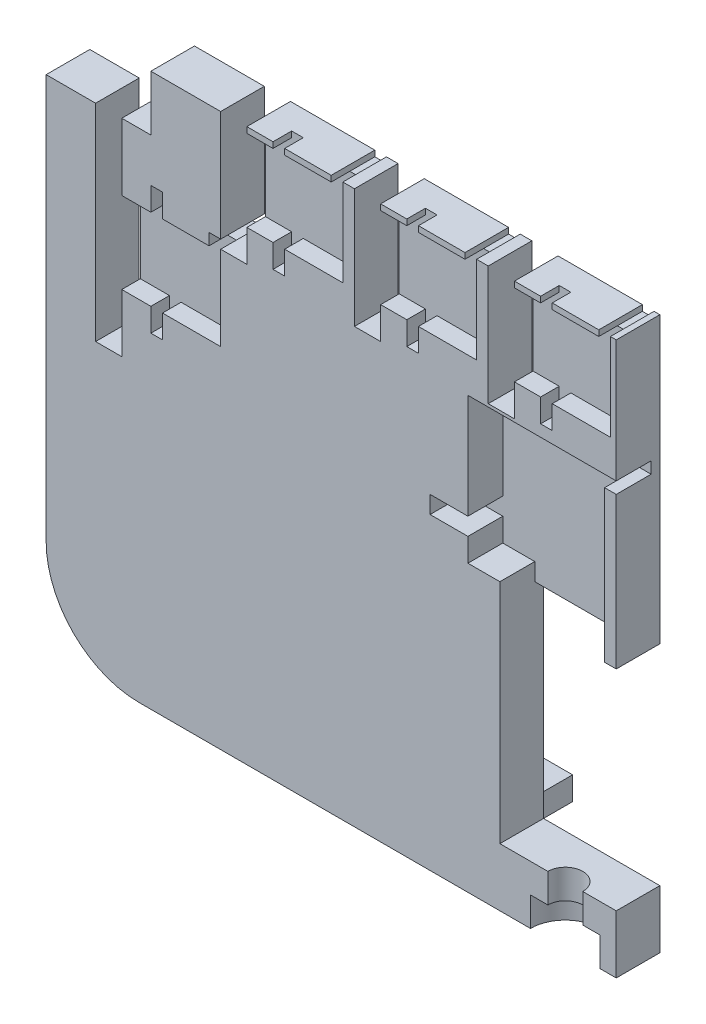
from build123d import *
from OCP.BRepAlgoAPI import BRepAlgoAPI_Cut
from OCP.TopTools import TopTools_ListOfShape
from build123d.topology import SkipClean

# Parameters (mm, degrees)
BOSS_EXTRUDE1_DEPTH = 7.5
CUT_EXTRUDE1_DEPTH  = 3.2
CUT_EXTRUDE4_REACH  = 70.655
SKETCH5_W           = 3
SKETCH5_H           = 17
CUT_EXTRUDE5_REACH  = 70.655
SKETCH8_W           = 12
SKETCH8_H           = 37
CUT_EXTRUDE6_DEPTH  = 3.2
SKETCH10_W          = 10
SKETCH10_H          = 7.5
BOSS_EXTRUDE2_DEPTH = 27.486353186
SKETCH11_W          = 3
SKETCH11_H          = 7.5
CUT_EXTRUDE7_DEPTH  = 3.5
SKETCH12_W          = 2
SKETCH12_H          = 7.5
CUT_EXTRUDE8_DEPTH  = 4
SKETCH13_W          = 2
SKETCH13_H          = 7.5
CUT_EXTRUDE9_DEPTH  = 4
SKETCH14_W          = 7.5
SKETCH14_H          = 9.5
CUT_EXTRUDE10_DEPTH = 6
SKETCH16_W          = 1.5
SKETCH16_H          = 7.5
CUT_EXTRUDE12_DEPTH = 35.486360958
CUT_EXTRUDE13_DEPTH = 6
SKETCH19_W          = 17.5
SKETCH19_H          = 32
BOSS_EXTRUDE3_DEPTH = 7.5
CUT_EXTRUDE14_DEPTH = 6
SKETCH20_W          = 18
SKETCH20_H          = 6
CUT_EXTRUDE15_DEPTH = 6
SKETCH21_W          = 20
SKETCH21_H          = 33
CUT_EXTRUDE16_DEPTH = 11
CUT_EXTRUDE17_DEPTH = 5
CUT_EXTRUDE18_DEPTH = 10
SKETCH23_W          = 50
SKETCH23_H          = 4
BOSS_EXTRUDE4_DEPTH = 15
SKETCH25_R          = 3.5
CUT_EXTRUDE19_DEPTH = 10
SKETCH26_W          = 1.5
SKETCH26_H          = 20.5
CUT_EXTRUDE20_DEPTH = 8
SKETCH27_W          = 1.5
SKETCH27_H          = 20.5
CUT_EXTRUDE21_DEPTH = 8
SKETCH28_W          = 1.5
SKETCH28_H          = 20.5
CUT_EXTRUDE22_DEPTH = 8
CUT_EXTRUDE25_REACH = 73.857
SKETCH35_W          = 2
SKETCH35_H          = 2
SKETCH35_H_2        = 1
SKETCH36_W          = 1
SKETCH36_H          = 7.5
CUT_EXTRUDE26_DEPTH = 35.5
SKETCH37_W          = 7.5
SKETCH37_H          = 3
CUT_EXTRUDE27_DEPTH = 20


with BuildPart() as part:
    # Sketch1 → Boss-Extrude1 (new body)
    with BuildSketch(Plane.XY):
        with BuildLine():
            Line((-33, -47.5), (49, -47.5))
            Line((49, -47.5), (49, -29.5))
            Line((49, -29.5), (31.5, -29.5))
            Line((31.5, -29.5), (31.5, 2.5))
            Line((31.5, 2.5), (49, 2.5))
            Line((49, 2.5), (49, 47.5))
            Line((49, 47.5), (30, 47.5))
            Line((30, 47.5), (30, 30.5))
            Line((30, 30.5), (27, 30.5))
            Line((27, 30.5), (27, 47.5))
            Line((27, 47.5), (-49, 47.5))
            Line((-49, 47.5), (-49, -31.5))
            ThreePointArc((-49, -31.5), (-44.313708499, -42.813708499), (-33, -47.5))
        make_face()
    extrude(amount=BOSS_EXTRUDE1_DEPTH)

    # Sketch2 → Cut-Extrude1 (cut)
    with BuildSketch(Plane.XY.offset(7.5)):
        Polygon((30, 40), (31, 40), (31, 32.5), (36, 32.5), (36, 28.5), (38, 28.5), (38, 32.5), (48, 32.5), (48, 46.5), (38, 46.5), (38, 47.5), (36, 47.5), (36, 46.5), (31, 46.5), (31, 45), (30, 45), align=None)
        Polygon((-16, 40), (-15, 40), (-15, 32.5), (-10, 32.5), (-10, 28.5), (-8, 28.5), (-8, 32.5), (2, 32.5), (2, 46.5), (-8, 46.5), (-8, 47.5), (-10, 47.5), (-10, 46.5), (-15, 46.5), (-15, 45), (-16, 45), align=None)
        Polygon((7, 40), (8, 40), (8, 32.5), (13, 32.5), (13, 28.5), (15, 28.5), (15, 32.5), (25, 32.5), (25, 46.5), (15, 46.5), (15, 47.5), (13, 47.5), (13, 46.5), (8, 46.5), (8, 45), (7, 45), align=None)
    extrude(amount=-CUT_EXTRUDE1_DEPTH, mode=Mode.SUBTRACT)

    # Sketch5 → Cut-Extrude4 (cut, up to next)
    with BuildSketch(Plane.XY.offset(7.5), mode=Mode.PRIVATE) as cut_extrude4_sk1:
        with Locations((5.5, 39)):
            Rectangle(SKETCH5_W, SKETCH5_H)
    cut_extrude4_tool1 = extrude(cut_extrude4_sk1.sketch, amount=-CUT_EXTRUDE4_REACH, mode=Mode.PRIVATE) & part.part
    # Sketch5 → Cut-Extrude4 (cut, up to next)
    with BuildSketch(Plane.XY.offset(7.5), mode=Mode.PRIVATE) as cut_extrude4_sk2:
        with Locations((-17.5, 39)):
            Rectangle(SKETCH5_W, SKETCH5_H)
    cut_extrude4_tool2 = extrude(cut_extrude4_sk2.sketch, amount=-CUT_EXTRUDE4_REACH, mode=Mode.PRIVATE) & part.part
    add(cut_extrude4_tool1.solids().sort_by_distance((5.5, 39, 7.5))[0], mode=Mode.SUBTRACT)
    add(cut_extrude4_tool2.solids().sort_by_distance((-17.5, 39, 7.5))[0], mode=Mode.SUBTRACT)

    # Sketch8 → Cut-Extrude5 (cut, up to next)
    with BuildSketch(Plane.XY.offset(7.5), mode=Mode.PRIVATE) as cut_extrude5_sk1:
        with Locations((-43, 29)):
            Rectangle(SKETCH8_W, SKETCH8_H)
    cut_extrude5_tool1 = extrude(cut_extrude5_sk1.sketch, amount=-CUT_EXTRUDE5_REACH, mode=Mode.PRIVATE) & part.part
    add(cut_extrude5_tool1.solids().sort_by_distance((-43, 29, 7.5))[0], mode=Mode.SUBTRACT)

    # Sketch9 → Cut-Extrude6 (cut)
    with BuildSketch(Plane.XY.offset(7.5)):
        Polygon((-37, 20), (-36, 20), (-36, 12.5), (-31, 12.5), (-31, 8.5), (-29, 8.5), (-29, 12.5), (-19, 12.5), (-19, 26.5), (-29, 26.5), (-29, 30.5), (-31, 30.5), (-31, 26.5), (-36, 26.5), (-36, 25), (-37, 25), align=None)
    extrude(amount=-CUT_EXTRUDE6_DEPTH, mode=Mode.SUBTRACT)

    # Sketch10 → Boss-Extrude2 (add)
    with BuildSketch(Plane(origin=(0, 10.5, 0), x_dir=(1, 0, 0), z_dir=(0, 1, 0))):
        with Locations((-44, -3.75)):
            Rectangle(SKETCH10_W, SKETCH10_H)
    extrude(amount=BOSS_EXTRUDE2_DEPTH)

    # Sketch11 → Cut-Extrude7 (cut)
    with BuildSketch(Plane(origin=(0, 30.5, 0), x_dir=(1, 0, 0), z_dir=(0, 1, 0))):
        with Locations((-17.5, -3.75)):
            Rectangle(SKETCH11_W, SKETCH11_H)
        with Locations((5.5, -3.75)):
            Rectangle(SKETCH11_W, SKETCH11_H)
        with Locations((28.5, -3.75)):
            Rectangle(SKETCH11_W, SKETCH11_H)
    extrude(amount=-CUT_EXTRUDE7_DEPTH, mode=Mode.SUBTRACT)

    # Sketch12 → Cut-Extrude8 (cut)
    with BuildSketch(Plane(origin=(0, 10.5, 0), x_dir=(1, 0, 0), z_dir=(0, 1, 0))):
        with Locations((-38, -3.75)):
            Rectangle(SKETCH12_W, SKETCH12_H)
    extrude(amount=-CUT_EXTRUDE8_DEPTH, mode=Mode.SUBTRACT)

    # Sketch13 → Cut-Extrude9 (cut)
    with BuildSketch(Plane(origin=(0, 6.5, 0), x_dir=(1, 0, 0), z_dir=(0, 1, 0))):
        with Locations((-38, -3.75)):
            Rectangle(SKETCH13_W, SKETCH13_H)
    extrude(amount=-CUT_EXTRUDE9_DEPTH, mode=Mode.SUBTRACT)

    # Sketch14 → Cut-Extrude10 (cut)
    with BuildSketch(Plane.ZY.offset(37)):
        with Locations((3.75, 42.75)):
            Rectangle(SKETCH14_W, SKETCH14_H)
    extrude(amount=-CUT_EXTRUDE10_DEPTH, mode=Mode.SUBTRACT)


with BuildPart() as cut_extrude12_tool:
    # Sketch16 → Cut-Extrude12 (new body)
    with BuildSketch(Plane(origin=(0, 37.986353186, 0), x_dir=(1, 0, 0), z_dir=(0, 1, 0))):
        with Locations((-39.75, -3.75)):
            Rectangle(SKETCH16_W, SKETCH16_H)
    extrude(amount=-CUT_EXTRUDE12_DEPTH)


with BuildPart() as part_1:
    add(part.part)

    # Cut-Extrude12: cut by cut_extrude12_tool, with a tolerance
    cut_extrude12_stock = TopTools_ListOfShape()
    cut_extrude12_stock.Append(part_1.part.wrapped)
    cut_extrude12_tools = TopTools_ListOfShape()
    cut_extrude12_tools.Append(cut_extrude12_tool.part.wrapped)
    cut_extrude12_cut = BRepAlgoAPI_Cut()
    cut_extrude12_cut.SetArguments(cut_extrude12_stock)
    cut_extrude12_cut.SetTools(cut_extrude12_tools)
    cut_extrude12_cut.SetFuzzyValue(0.00001)
    cut_extrude12_cut.Build()
    add(Compound.cast(cut_extrude12_cut.Shape()).solids(), mode=Mode.REPLACE)

    # Sketch18 → Cut-Extrude13 (cut)
    with SkipClean():  # the faces are left unmerged after this step: merging them gives an invalid solid
        with BuildSketch(Plane.XY.offset(7.5)):
            Polygon((23.5, 5.5), (23.5, 1.5), (47, 1.5), (47, 24.5), (49, 24.5), (49, 26.5), (47, 26.5), (23.5, 26.5), (23.5, 8.5), (17, 8.5), (17, 5.5), align=None)
        extrude(amount=-CUT_EXTRUDE13_DEPTH, mode=Mode.SUBTRACT)

    # Sketch19 → Boss-Extrude3 (add)
    with SkipClean():  # the faces are left unmerged after this step: merging them gives an invalid solid
        with BuildSketch(Plane(origin=(0, 0, 0), x_dir=(-1, 0, 0), z_dir=(0, 0, -1))):
            with Locations((-40.25, -13.5)):
                Rectangle(SKETCH19_W, SKETCH19_H)
        extrude(amount=-BOSS_EXTRUDE3_DEPTH)

    # Sketch18<2> → Cut-Extrude14 (cut)
    with SkipClean():  # the faces are left unmerged after this step: merging them gives an invalid solid
        with BuildSketch(Plane.XY.offset(7.5)):
            Polygon((23.5, 5.5), (23.5, 1.5), (47, 1.5), (47, 24.5), (49, 24.5), (49, 26.5), (47, 26.5), (23.5, 26.5), (23.5, 8.5), (17, 8.5), (17, 5.5), align=None)
        extrude(amount=-CUT_EXTRUDE14_DEPTH, mode=Mode.SUBTRACT)

    # Sketch20 → Cut-Extrude15 (cut)
    with SkipClean():  # the faces are left unmerged after this step: merging them gives an invalid solid
        with BuildSketch(Plane.XY.offset(7.5)):
            with Locations((38, -1.5)):
                Rectangle(SKETCH20_W, SKETCH20_H)
        extrude(amount=-CUT_EXTRUDE15_DEPTH, mode=Mode.SUBTRACT)

    # Sketch21 → Cut-Extrude16 (cut)
    with SkipClean():  # the faces are left unmerged after this step: merging them gives an invalid solid
        with BuildSketch(Plane.XY.offset(7.5)):
            with Locations((39, -21)):
                Rectangle(SKETCH21_W, SKETCH21_H)
        extrude(amount=-CUT_EXTRUDE16_DEPTH, mode=Mode.SUBTRACT)

    # Sketch3 → Cut-Extrude17 (cut)
    with SkipClean():  # the faces are left unmerged after this step: merging them gives an invalid solid
        with BuildSketch(Plane.XZ.offset(47.5)):
            with BuildLine():
                Line((34.25, 7.5), (46.25, 7.5))
                ThreePointArc((46.25, 7.5), (40.25, 1.5), (34.25, 7.5))
            make_face()
        extrude(amount=-CUT_EXTRUDE17_DEPTH, mode=Mode.SUBTRACT)

    # Sketch22 → Cut-Extrude18 (cut)
    with SkipClean():  # the faces are left unmerged after this step: merging them gives an invalid solid
        with BuildSketch(Plane.XZ.offset(42.5)):
            with BuildLine():
                Line((37.25, 7.5), (43.25, 7.5))
                ThreePointArc((43.25, 7.5), (40.25, 4.5), (37.25, 7.5))
            make_face()
        extrude(amount=-CUT_EXTRUDE18_DEPTH, mode=Mode.SUBTRACT)

    # Sketch23 → Boss-Extrude4 (add)
    with SkipClean():  # the faces are left unmerged after this step: merging them gives an invalid solid
        with BuildSketch(Plane(origin=(0, 0, 0), x_dir=(-1, 0, 0), z_dir=(0, 0, -1))):
            with Locations((6, -45.5)):
                Rectangle(SKETCH23_W, SKETCH23_H)
        extrude(amount=BOSS_EXTRUDE4_DEPTH)

    # Sketch25 → Cut-Extrude19 (cut)
    with SkipClean():  # the faces are left unmerged after this step: merging them gives an invalid solid
        with BuildSketch(Plane(origin=(0, -47.5, 0), x_dir=(-1, 0, 0), z_dir=(0, -1, 0))):
            with Locations(Location((-1, 7.5, 0), (0, 0, 180))):
                Circle(SKETCH25_R)
        extrude(amount=-CUT_EXTRUDE19_DEPTH, mode=Mode.SUBTRACT)

    # Sketch26 → Cut-Extrude20 (cut)
    with SkipClean():  # the faces are left unmerged after this step: merging them gives an invalid solid
        with BuildSketch(Plane(origin=(0, 0, 0), x_dir=(-1, 0, 0), z_dir=(0, 0, -1))):
            with Locations((-30.75, 37.25)):
                Rectangle(SKETCH26_W, SKETCH26_H)
        extrude(amount=-CUT_EXTRUDE20_DEPTH, mode=Mode.SUBTRACT)

    # Sketch27 → Cut-Extrude21 (cut)
    with SkipClean():  # the faces are left unmerged after this step: merging them gives an invalid solid
        with BuildSketch(Plane(origin=(0, 0, 0), x_dir=(-1, 0, 0), z_dir=(0, 0, -1))):
            with Locations((-7.75, 37.25)):
                Rectangle(SKETCH27_W, SKETCH27_H)
        extrude(amount=-CUT_EXTRUDE21_DEPTH, mode=Mode.SUBTRACT)

    # Sketch28 → Cut-Extrude22 (cut)
    with SkipClean():  # the faces are left unmerged after this step: merging them gives an invalid solid
        with BuildSketch(Plane(origin=(0, 0, 0), x_dir=(-1, 0, 0), z_dir=(0, 0, -1))):
            with Locations((15.25, 37.25)):
                Rectangle(SKETCH28_W, SKETCH28_H)
        extrude(amount=-CUT_EXTRUDE22_DEPTH, mode=Mode.SUBTRACT)

    # Sketch35 → Cut-Extrude25 (cut, up to next)
    with BuildSketch(Plane.XY.offset(7.5), mode=Mode.PRIVATE) as cut_extrude25_sk1:
        with Locations((-20, 27.5)):
            Rectangle(SKETCH35_W, SKETCH35_H)
    cut_extrude25_tool1 = extrude(cut_extrude25_sk1.sketch, amount=-CUT_EXTRUDE25_REACH, mode=Mode.PRIVATE) & part_1.part
    # Sketch35 → Cut-Extrude25 (cut, up to next)
    with BuildSketch(Plane.XY.offset(7.5), mode=Mode.PRIVATE) as cut_extrude25_sk2:
        with Locations((1, 47)):
            Rectangle(SKETCH35_W, SKETCH35_H_2)
    cut_extrude25_tool2 = extrude(cut_extrude25_sk2.sketch, amount=-CUT_EXTRUDE25_REACH, mode=Mode.PRIVATE) & part_1.part
    # Sketch35 → Cut-Extrude25 (cut, up to next)
    with BuildSketch(Plane.XY.offset(7.5), mode=Mode.PRIVATE) as cut_extrude25_sk3:
        with Locations((24, 47)):
            Rectangle(SKETCH35_W, SKETCH35_H_2)
    cut_extrude25_tool3 = extrude(cut_extrude25_sk3.sketch, amount=-CUT_EXTRUDE25_REACH, mode=Mode.PRIVATE) & part_1.part
    # Sketch35 → Cut-Extrude25 (cut, up to next)
    with BuildSketch(Plane.XY.offset(7.5), mode=Mode.PRIVATE) as cut_extrude25_sk4:
        with Locations((47, 47)):
            Rectangle(SKETCH35_W, SKETCH35_H_2)
    cut_extrude25_tool4 = extrude(cut_extrude25_sk4.sketch, amount=-CUT_EXTRUDE25_REACH, mode=Mode.PRIVATE) & part_1.part
    add(cut_extrude25_tool1.solids().sort_by_distance((-20, 27.5, 7.5))[0], mode=Mode.SUBTRACT)
    add(cut_extrude25_tool2.solids().sort_by_distance((1, 47, 7.5))[0], mode=Mode.SUBTRACT)
    add(cut_extrude25_tool3.solids().sort_by_distance((24, 47, 7.5))[0], mode=Mode.SUBTRACT)
    add(cut_extrude25_tool4.solids().sort_by_distance((47, 47, 7.5))[0], mode=Mode.SUBTRACT)

    # Sketch36 → Cut-Extrude26 (cut)
    with SkipClean():  # the faces are left unmerged after this step: merging them gives an invalid solid
        with BuildSketch(Plane(origin=(0, 38, 0), x_dir=(1, 0, 0), z_dir=(0, 1, 0))):
            with Locations((-36.5, -3.75)):
                Rectangle(SKETCH36_W, SKETCH36_H)
        extrude(amount=-CUT_EXTRUDE26_DEPTH, mode=Mode.SUBTRACT)

    # Sketch37 → Cut-Extrude27 (cut)
    with SkipClean():  # the faces are left unmerged after this step: merging them gives an invalid solid
        with BuildSketch(Plane(origin=(49, 0, 0), x_dir=(0, 0, -1), z_dir=(1, 0, 0))):
            with Locations((-3.75, -3)):
                Rectangle(SKETCH37_W, SKETCH37_H)
        extrude(amount=-CUT_EXTRUDE27_DEPTH, mode=Mode.SUBTRACT)


solid = part_1.part
